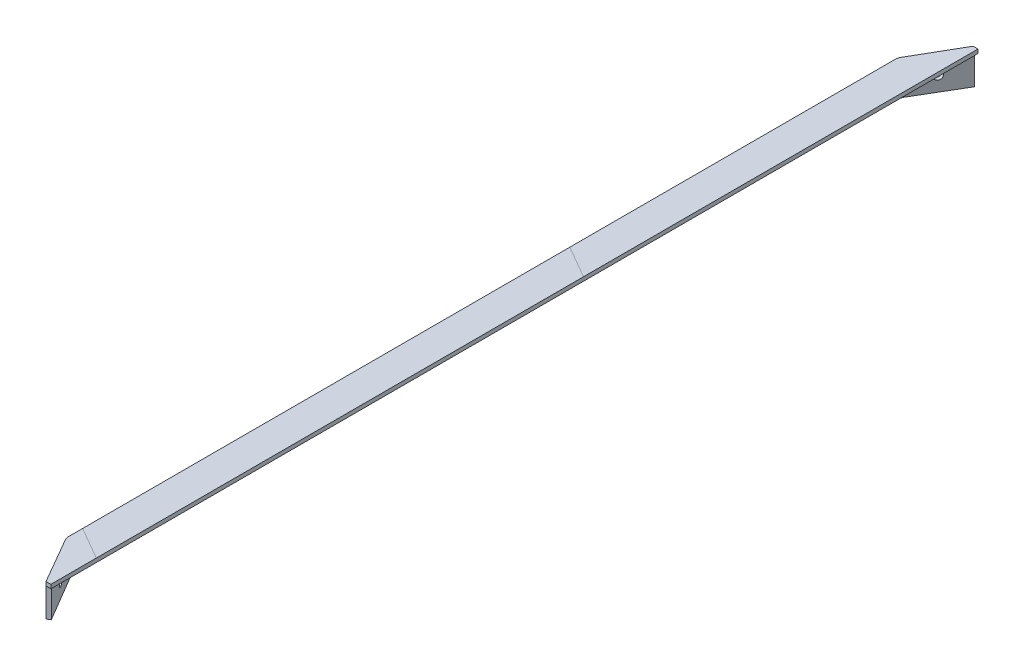
from build123d import *

# Parameters (mm, degrees)
BOSS_EXTRUDE1_DEPTH = 640
BOSS_EXTRUDE2_DEPTH = 6
BOSS_EXTRUDE3_DEPTH = 44
SKETCH6_R           = 6
CUT_EXTRUDE1_DEPTH  = 6
FILLET1_R           = 10


with BuildPart() as part:
    # Sketch1 → Boss-Extrude1 (new body)
    with BuildSketch(Plane.XY):
        Polygon((44, 6), (44, 0), (0, 0), (0, -44), (-6, -44), (-6, 6), align=None)
    boss_extrude1 = extrude(amount=BOSS_EXTRUDE1_DEPTH)

    # Sketch4 → Boss-Extrude2 (add)
    with BuildSketch(Plane(origin=(0, 0, 0), x_dir=(1, 0, 0), z_dir=(0, 1, 0))):
        Polygon((-6, -640), (36.5, -713.612159322), (44, -713.612159322), (44, -640), align=None)
    boss_extrude2 = extrude(amount=BOSS_EXTRUDE2_DEPTH)

    # Sketch5 → Boss-Extrude3 (add)
    with BuildSketch(Plane.XZ):
        Polygon((-6, 640), (36.5, 713.612159322), (41.696152423, 710.612159322), (0, 640), align=None)
    boss_extrude3 = extrude(amount=BOSS_EXTRUDE3_DEPTH)

    # Sketch6 → Cut-Extrude1 (cut)
    with BuildSketch(Plane(origin=(-280.211535478, 0, 165.463611454), x_dir=(-0.5084652327309545, 0, -0.861082520496065), z_dir=(0.861082520496065, 0, -0.5084652327309545))):
        with Locations((-592.096753089, -22)):
            Circle(SKETCH6_R)
    cut_extrude1 = extrude(amount=-CUT_EXTRUDE1_DEPTH, mode=Mode.SUBTRACT)

    # Mirror4: Boss-Extrude1, Boss-Extrude2, Boss-Extrude3, Cut-Extrude1 across plane
    add(boss_extrude1.mirror(Plane.XY))
    add(boss_extrude2.mirror(Plane.XY))
    add(boss_extrude3.mirror(Plane.XY))
    add(cut_extrude1.mirror(Plane.XY), mode=Mode.SUBTRACT)

    # Fillet1
    fillet1_edges = [part.edges().sort_by_distance(p)[0] for p in [
        (-6, -19, 640),
        (-6, -19, -640),
        (0, -22, -640),
        (0, -22, 640),
    ]]
    fillet(fillet1_edges, radius=FILLET1_R)


solid = part.part
